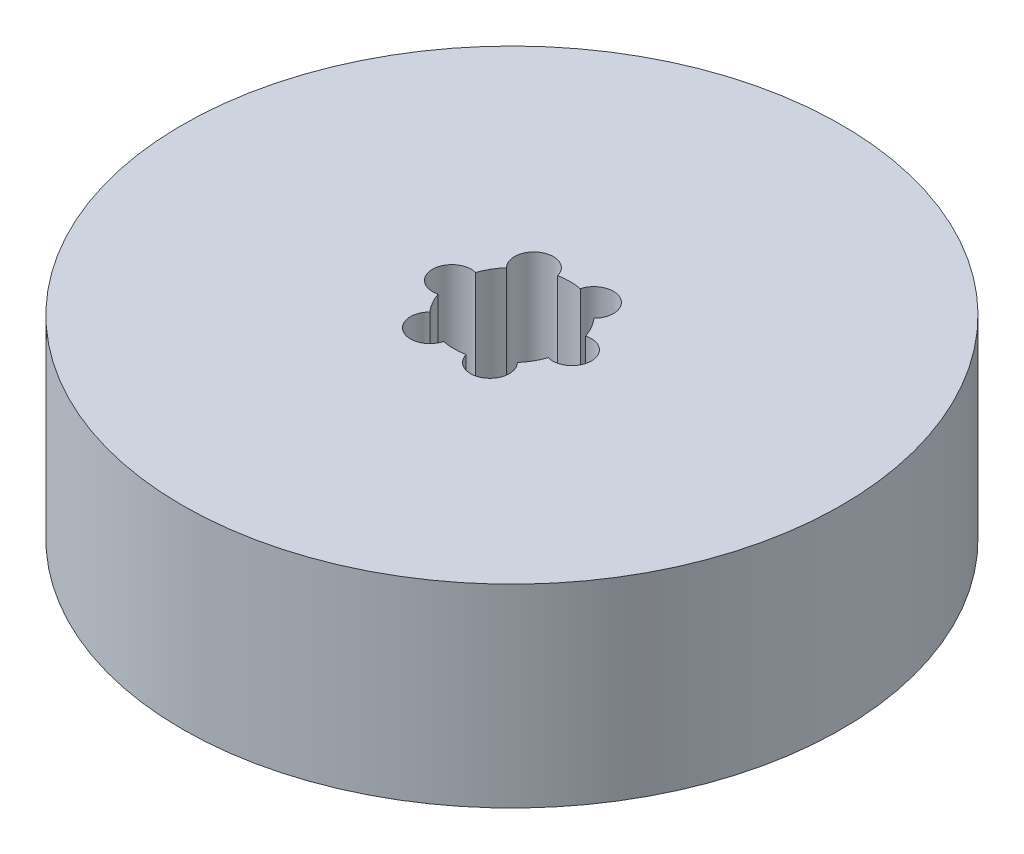
from build123d import *

# Parameters (mm, degrees)
SKETCH1_R           = 42.5
BOSS_EXTRUDE1_DEPTH = 25
SKETCH2_R           = 7.5
CUT_EXTRUDE1_DEPTH  = 66.096082831
SKETCH3_R           = 2.500705788
CUT_EXTRUDE2_DEPTH  = 16.174750041
CIRPATTERN1_COUNT   = 6


with BuildPart() as part:
    # Sketch1 → Boss-Extrude1 (new body)
    with BuildSketch(Plane(origin=(0, 0, 0), x_dir=(1, 0, 0), z_dir=(0, 1, 0))):
        Circle(SKETCH1_R)
    extrude(amount=BOSS_EXTRUDE1_DEPTH)

    # Sketch2 → Cut-Extrude1 (cut, through all)
    with BuildSketch(Plane(origin=(0, 0, 0), x_dir=(1, 0, 0), z_dir=(0, 1, 0))):
        Circle(SKETCH2_R)
    extrude(amount=CUT_EXTRUDE1_DEPTH, mode=Mode.SUBTRACT)

    # Sketch3 → Cut-Extrude2 (cut)
    with BuildSketch(Plane(origin=(0, 25, 0), x_dir=(1, 0, 0), z_dir=(0, 1, 0))):
        with Locations((-7.746333105, 0)):
            Circle(SKETCH3_R)
    cut_extrude2 = extrude(amount=-CUT_EXTRUDE2_DEPTH, mode=Mode.SUBTRACT)

    # CirPattern1: Cut-Extrude2 ×6 about axis
    cirpattern1_axis = Axis((0, 0, 0), (0, 1, 0))
    for i in range(1, CIRPATTERN1_COUNT):
        add(cut_extrude2.rotate(cirpattern1_axis, i * 360 / CIRPATTERN1_COUNT), mode=Mode.SUBTRACT)


solid = part.part
